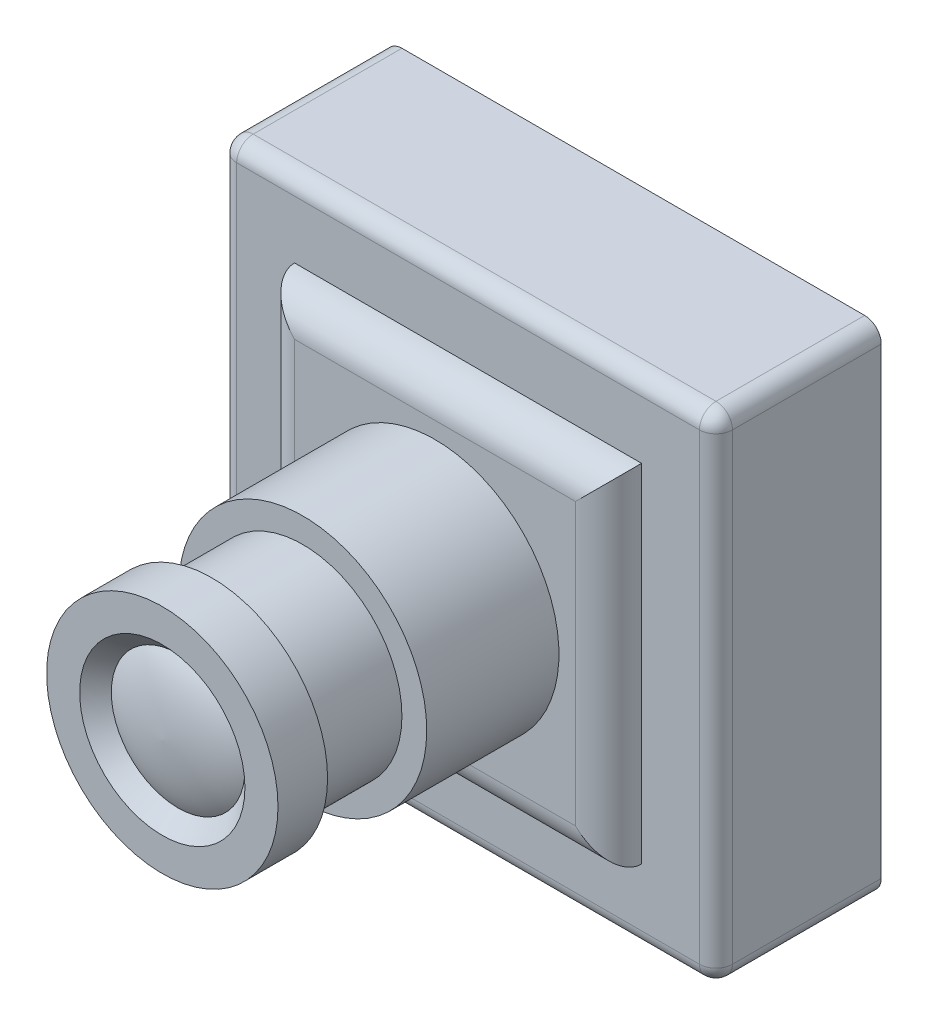
from build123d import *

# Parameters (mm, degrees)
SKETCH1_W          = 30
SKETCH1_H          = 30
EXTRUDE1_DEPTH     = 10
SKETCH2_W          = 21
SKETCH2_H          = 21
EXTRUDE2_DEPTH     = 2
SKETCH3_R          = 7.5
EXTRUDE3_DEPTH     = 8
SKETCH4_R          = 6
EXTRUDE4_DEPTH     = 5.5
SKETCH5_R          = 7
EXTRUDE5_DEPTH     = 3
SKETCH6_R          = 5
CUT_EXTRUDE1_DEPTH = 3
CHAMFER1_SIZE      = 3
FILLET1_R          = 1
FILLET2_R          = 2


with BuildPart() as part:
    # Sketch1 → Extrude1 (new body)
    with BuildSketch(Plane.XY):
        Rectangle(SKETCH1_W, SKETCH1_H)
    extrude(amount=EXTRUDE1_DEPTH)

    # Sketch2 → Extrude2 (add)
    with BuildSketch(Plane.XY.offset(10)):
        Rectangle(SKETCH2_W, SKETCH2_H)
    extrude(amount=EXTRUDE2_DEPTH)

    # Sketch3 → Extrude3 (add)
    with BuildSketch(Plane.XY.offset(12)):
        with Locations(Location((0, 0, 0), (0, 0, 180))):
            Circle(SKETCH3_R)
    extrude(amount=EXTRUDE3_DEPTH)

    # Sketch4 → Extrude4 (add)
    with BuildSketch(Plane.XY.offset(20)):
        Circle(SKETCH4_R)
    extrude(amount=EXTRUDE4_DEPTH)

    # Sketch5 → Extrude5 (add)
    with BuildSketch(Plane.XY.offset(25.5)):
        Circle(SKETCH5_R)
    extrude(amount=EXTRUDE5_DEPTH)

    # Sketch6 → Cut-Extrude1 (cut)
    with BuildSketch(Plane.XY.offset(28.5)):
        Circle(SKETCH6_R)
    extrude(amount=-CUT_EXTRUDE1_DEPTH, mode=Mode.SUBTRACT)

    # Chamfer1
    chamfer1_edges = [part.edges().sort_by_distance(p)[0] for p in [
        (-5, 0, 25.5),
    ]]
    chamfer(chamfer1_edges, length=CHAMFER1_SIZE - 0.0001)  # a hair under: the kernel refuses the full size

    # Sketch8 → Revolve1 (revolve)
    with BuildSketch(Plane(origin=(0, 0, 0), x_dir=(0, 0, -1), z_dir=(1, 0, 0)), mode=Mode.PRIVATE) as revolve1_sk:
        with BuildLine():
            Line((-25.5, 0), (-25.5, 6))
            add(Edge.make_bspline(
                [(-28.5, 0), (-28.329286333, 3.962436502), (-27.079878372, 4.87576544), (-25.5, 6)],
                knots=[0, 0, 0, 0, 1, 1, 1, 1], degree=3))
            Line((-28.5, 0), (-25.5, 0))
        make_face()
    revolve(revolve1_sk.sketch.rotate(Axis((0, 0, 28.5), (0, 0, -1)), 90), axis=Axis((0, 0, 28.5), (0, 0, -1)))

    # Fillet1
    fillet1_edges = [part.edges().sort_by_distance(p)[0] for p in [
        (15, 0, 10),
        (0, 15, 10),
        (-15, 0, 10),
        (0, -15, 10),
        (-15, 15, 5),
        (15, 15, 5),
        (15, -15, 5),
        (-15, -15, 5),
    ]]
    fillet(fillet1_edges, radius=FILLET1_R)

    # Fillet2
    fillet2_edges = [part.edges().sort_by_distance(p)[0] for p in [
        (0, -10.5, 12),
        (10.5, 0, 12),
        (0, 10.5, 12),
        (-10.5, 0, 12),
    ]]
    fillet(fillet2_edges, radius=FILLET2_R - 0.0001)  # a hair under: the kernel refuses the full size


solid = part.part
